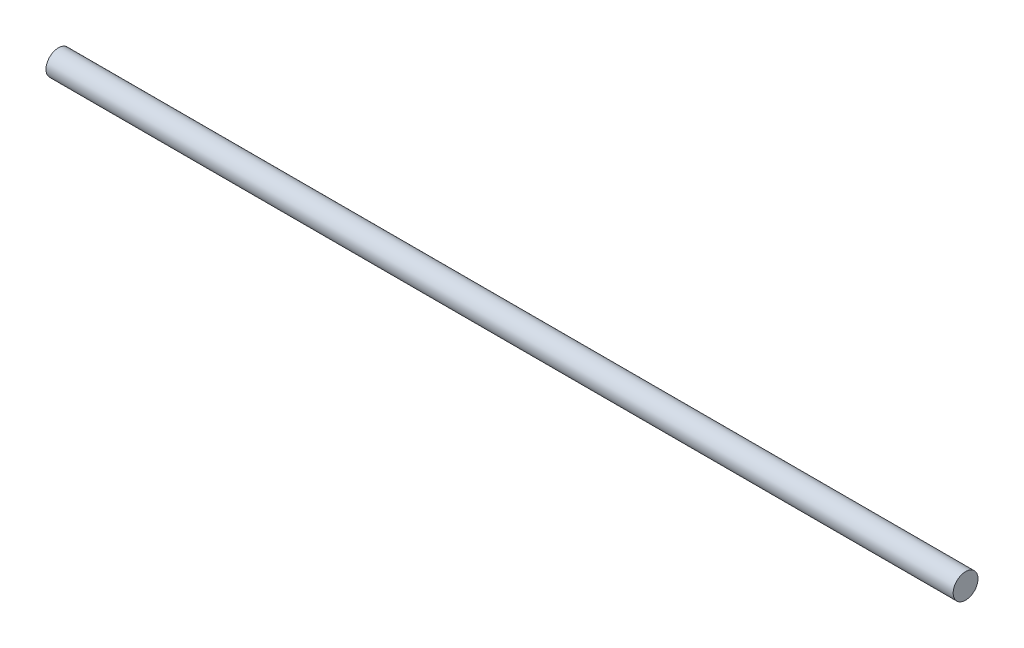
from build123d import *

# Parameters (mm, degrees)
SKETCH1_R           = 2.38125
BOSS_EXTRUDE1_DEPTH = 174.07800016


with BuildPart() as part:
    # Sketch1 → Boss-Extrude1 (new body)
    with BuildSketch(Plane(origin=(0, 0, 0), x_dir=(0, 0, -1), z_dir=(1, 0, 0))):
        Circle(SKETCH1_R)
    extrude(amount=BOSS_EXTRUDE1_DEPTH)


solid = part.part
